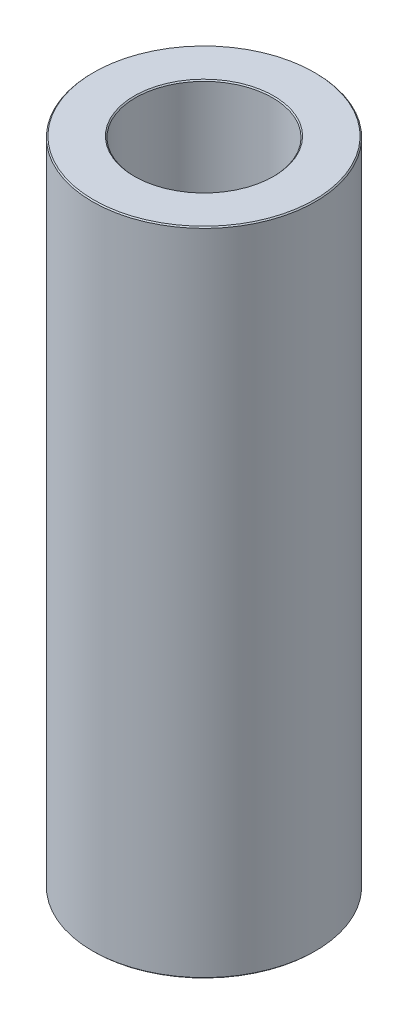
from build123d import *

# Parameters (mm, degrees)
SKETCH1_R           = 32.5
BOSS_EXTRUDE1_DEPTH = 189.784245099
SKETCH2_R           = 20.009133011
CUT_EXTRUDE1_DEPTH  = 196.27047828
CHAMFER1_SIZE       = 0.319615731


with BuildPart() as part:
    # Sketch1 → Boss-Extrude1 (new body)
    with BuildSketch(Plane(origin=(0, 0, 0), x_dir=(1, 0, 0), z_dir=(0, 1, 0))):
        Circle(SKETCH1_R)
    extrude(amount=BOSS_EXTRUDE1_DEPTH)

    # Sketch2 → Cut-Extrude1 (cut, through all)
    with BuildSketch(Plane(origin=(0, 0, 0), x_dir=(1, 0, 0), z_dir=(0, 1, 0))):
        Circle(SKETCH2_R)
    extrude(amount=CUT_EXTRUDE1_DEPTH, mode=Mode.SUBTRACT)

    # Chamfer1
    chamfer1_edges = [part.edges().sort_by_distance(p)[0] for p in [
        (-20.009133011, 189.784245099, 0),
        (-20.009133011, 0, 0),
        (-32.5, 0, 0),
        (-32.5, 189.784245099, 0),
    ]]
    chamfer(chamfer1_edges, length=CHAMFER1_SIZE)


solid = part.part
